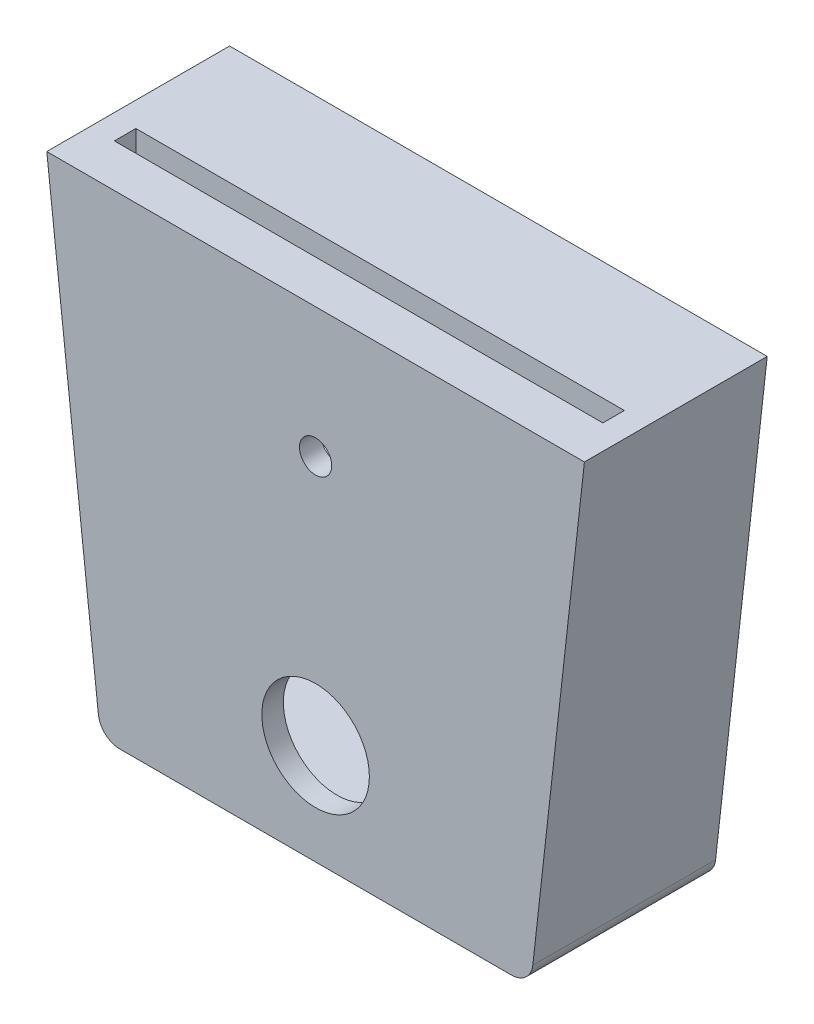
from build123d import *

# Parameters (mm, degrees)
SKETCH1_R           = 3.81
SKETCH1_R_2         = 12.7
BOSS_EXTRUDE1_DEPTH = 5.08
BOSS_EXTRUDE2_DEPTH = 38.1
SKETCH3_W           = 115.38555028
SKETCH3_H           = 5.08
CUT_EXTRUDE2_DEPTH  = 6.35
BOSS_EXTRUDE3_DEPTH = 2.54
SKETCH5_R           = 1.905
CUT_EXTRUDE3_DEPTH  = 2.54


with BuildPart() as part:
    # Sketch1 → Boss-Extrude1 (new body)
    with BuildSketch(Plane.XY):
        with BuildLine():
            Line((63.5, 56.7961272), (-63.5, 56.7961272))
            Line((-63.5, 56.7961272), (-51.304854459, -52.280570501))
            ThreePointArc((-51.304854459, -52.280570501), (-49.642976536, -55.502534499), (-46.25630987, -56.796126057))
            Line((-46.25630987, -56.796126057), (46.25630987, -56.796126057))
            ThreePointArc((46.25630987, -56.796126057), (49.642976536, -55.502534499), (51.304854459, -52.280570501))
            Line((51.304854459, -52.280570501), (63.5, 56.7961272))
        make_face()
        with Locations((0, 26.169334365)):
            Circle(SKETCH1_R, mode=Mode.SUBTRACT)
        with Locations((0, -32.979057905)):
            Circle(SKETCH1_R_2, mode=Mode.SUBTRACT)
    extrude(amount=-BOSS_EXTRUDE1_DEPTH)

    # Sketch2 → Boss-Extrude2 (add)
    with BuildSketch(Plane.XY.offset(-5.08)):
        with BuildLine():
            Line((63.5, 56.7961272), (-63.5, 56.7961272))
            Line((-63.5, 56.7961272), (-51.304854459, -52.280570501))
            ThreePointArc((-51.304854459, -52.280570501), (-49.642976536, -55.502534499), (-46.25630987, -56.796126057))
            Line((-46.25630987, -56.796126057), (46.25630987, -56.796126057))
            ThreePointArc((46.25630987, -56.796126057), (49.642976536, -55.502534499), (51.304854459, -52.280570501))
            Line((51.304854459, -52.280570501), (63.5, 56.7961272))
        make_face()
        with BuildLine():
            Line((41.712619739, -51.716126057), (-41.712619739, -51.716126057))
            ThreePointArc((-41.712619739, -51.716126057), (-45.099286406, -50.422534499), (-46.761164329, -47.200570501))
            Line((-46.761164329, -47.200570501), (-57.692775499, 50.574732221))
            Line((-57.692775499, 50.574732221), (57.692775499, 50.574732221))
            Line((57.692775499, 50.574732221), (46.761164329, -47.200570501))
            ThreePointArc((46.761164329, -47.200570501), (45.099286406, -50.422534499), (41.712619739, -51.716126057))
        make_face(mode=Mode.SUBTRACT)
    extrude(amount=-BOSS_EXTRUDE2_DEPTH)

    # Sketch3 → Cut-Extrude2 (cut)
    with BuildSketch(Plane(origin=(0, 56.7961272, 0), x_dir=(1, 0, 0), z_dir=(0, 1, 0))):
        with Locations((2.54e-06, 12.7)):
            Rectangle(SKETCH3_W, SKETCH3_H)
    extrude(amount=-CUT_EXTRUDE2_DEPTH, mode=Mode.SUBTRACT)

    # Sketch4 → Boss-Extrude3 (add)
    with BuildSketch(Plane(origin=(0, 0, -43.18), x_dir=(-1, 0, 0), z_dir=(0, 0, -1))):
        Polygon((-52.99583525, 8.564021488), (-33.94583525, 8.564021488), (-33.94583525, -4.135978512), (-51.575932084, -4.135978512), align=None)
        Polygon((33.94583525, -4.135978512), (51.575932084, -4.135978512), (52.99583525, 8.564021488), (33.94583525, 8.564021488), align=None)
    extrude(amount=-BOSS_EXTRUDE3_DEPTH)

    # Sketch5 → Cut-Extrude3 (cut)
    with BuildSketch(Plane(origin=(0, 0, -43.18), x_dir=(-1, 0, 0), z_dir=(0, 0, -1))):
        with Locations((-43.115859459, 2.214021488)):
            Circle(SKETCH5_R)
        with Locations((43.115859459, 2.214021488)):
            Circle(SKETCH5_R)
    extrude(amount=-CUT_EXTRUDE3_DEPTH, mode=Mode.SUBTRACT)


solid = part.part
